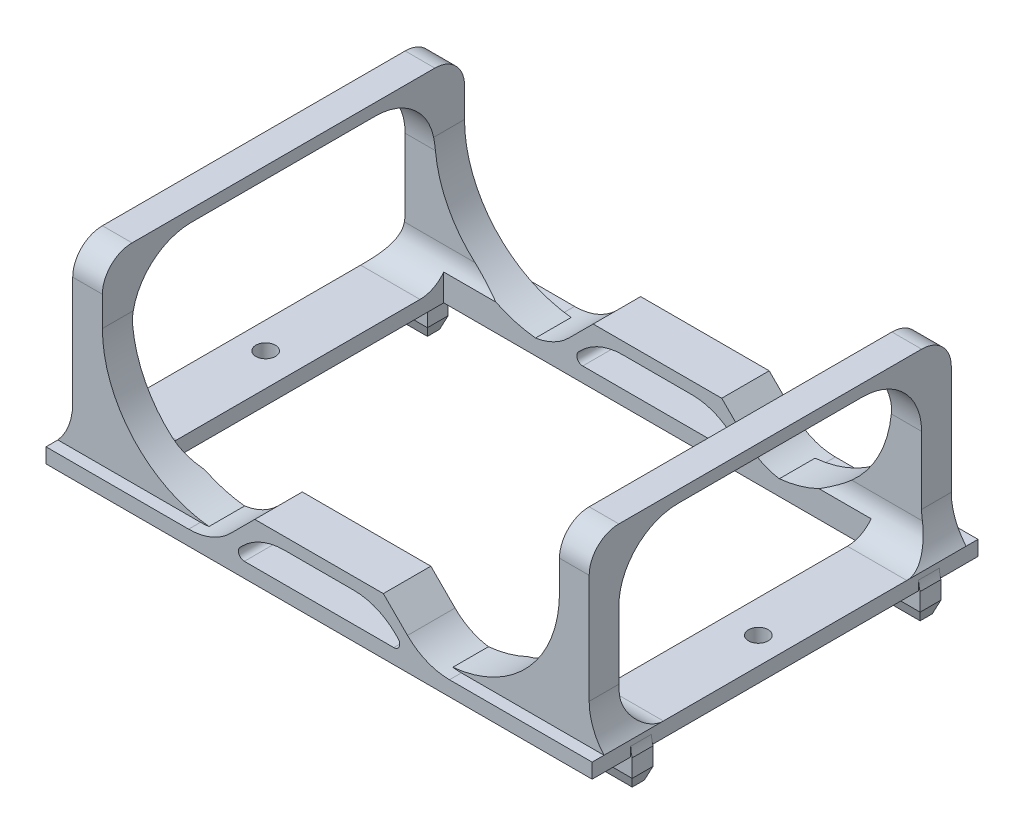
from build123d import *
from OCP.BRepFilletAPI import BRepFilletAPI_MakeChamfer

# Parameters (mm, degrees)
SKETCH1_W           = 10
SKETCH1_H           = 8
SKETCH1_W_2         = 72
SKETCH1_H_2         = 49
BOSS_EXTRUDE1_DEPTH = 2.5
SKETCH2_W           = 5
SKETCH2_H           = 5
BOSS_EXTRUDE2_DEPTH = 30
SKETCH3_W           = 5
SKETCH3_H           = 2
BOSS_EXTRUDE3_DEPTH = 56
EXTRUDE_THIN1_START = -8
EXTRUDE_THIN1_DEPTH = 8
LPATTERN1_START     = -32.5
LPATTERN1_DEPTH     = 57
SKETCH5_W           = 39.65685425
SKETCH5_H           = 49
CUT_EXTRUDE2_DEPTH  = 65.778468645
FILLET1_R           = 20
FILLET2_R           = 10
FILLET3_R           = 5
FILLET4_START       = -32.5
FILLET4_DEPTH       = 8
FILLET4_START_2     = 24.5
FILLET4_2_DEPTH     = 8
FILLET5_R           = 10
FILLET6_R           = 5
FILLET7_R           = 10
FILLET8_R           = 1
SKETCH6_R           = 1.65
CUT_EXTRUDE3_DEPTH  = 2.5
SKETCH7_W           = 9.5
SKETCH7_H           = 3.5
BOSS_EXTRUDE4_DEPTH = 5
CHAMFER1_SIZE       = 2
CHAMFER1_SIZE2      = 0.727940469
FILLET9_R           = 5


with BuildPart() as part:
    # Sketch1 → Boss-Extrude1 (new body)
    with BuildSketch(Plane(origin=(0, 0, 0), x_dir=(1, 0, 0), z_dir=(0, 1, 0))):
        with Locations((-41, 28.5)):
            Rectangle(SKETCH1_W, SKETCH1_H)
        with Locations((0, 28.5)):
            Rectangle(SKETCH1_W_2, SKETCH1_H)
        with Locations((-41, 0)):
            Rectangle(SKETCH1_W, SKETCH1_H_2)
        with Locations((0, -28.5)):
            Rectangle(SKETCH1_W_2, SKETCH1_H)
        with Locations((-41, -28.5)):
            Rectangle(SKETCH1_W, SKETCH1_H)
        with Locations((41, -28.5)):
            Rectangle(SKETCH1_W, SKETCH1_H)
        with Locations((41, 0)):
            Rectangle(SKETCH1_W, SKETCH1_H_2)
        with Locations((41, 28.5)):
            Rectangle(SKETCH1_W, SKETCH1_H)
    extrude(amount=BOSS_EXTRUDE1_DEPTH)

    # Sketch2 → Boss-Extrude2 (add)
    with BuildSketch(Plane(origin=(0, 2.5, 0), x_dir=(1, 0, 0), z_dir=(0, 1, 0))):
        with Locations((-41, 28)):
            Rectangle(SKETCH2_W, SKETCH2_H)
        with Locations((41, 28)):
            Rectangle(SKETCH2_W, SKETCH2_H)
        with Locations((41, -28)):
            Rectangle(SKETCH2_W, SKETCH2_H)
        with Locations((-41, -28)):
            Rectangle(SKETCH2_W, SKETCH2_H)
    extrude(amount=BOSS_EXTRUDE2_DEPTH)

    # Sketch3 → Boss-Extrude3 (add)
    with BuildSketch(Plane.XY.offset(30.5)):
        with Locations((-41, 31.5)):
            Rectangle(SKETCH3_W, SKETCH3_H)
        with Locations((41, 31.5)):
            Rectangle(SKETCH3_W, SKETCH3_H)
    extrude(amount=-BOSS_EXTRUDE3_DEPTH)

    # Sketch4 → Extrude-Thin1 (add)
    with BuildSketch(Plane.XY.offset(32.5).offset(EXTRUDE_THIN1_START)):
        Polygon((-19.828427125, 0.5), (-10.828427125, 9.5), (10.828427125, 9.5), (19.828427125, 0.5), align=None)
        Polygon((-15, 2.5), (-10, 7.5), (10, 7.5), (15, 2.5), align=None, mode=Mode.SUBTRACT)
    extrude(amount=EXTRUDE_THIN1_DEPTH)

    # LPattern1: read off the stored shape, not the designer's step
    # LPattern1 outline → LPattern1 (add)
    with BuildSketch(Plane.XY.offset(LPATTERN1_START)):
        Polygon((10.828427125, 9.5), (-10.828427125, 9.5), (-19.828427125, 0.5), (19.828427125, 0.5), align=None)
        Polygon((10, 7.5), (15, 2.5), (-15, 2.5), (-10, 7.5), align=None, mode=Mode.SUBTRACT)
    extrude(amount=LPATTERN1_DEPTH)

    # Sketch5 → Cut-Extrude2 (cut, through all)
    with BuildSketch(Plane.XZ.offset(-0.5)):
        Rectangle(SKETCH5_W, SKETCH5_H)
    extrude(amount=-CUT_EXTRUDE2_DEPTH, mode=Mode.SUBTRACT)

    # Fillet1
    fillet1_edges = [part.edges().sort_by_distance(p)[0] for p in [
        (-38.5, 2.5, -28),
        (38.5, 2.5, -28),
        (38.5, 2.5, 28),
        (-38.5, 2.5, 28),
    ]]
    fillet(fillet1_edges, radius=FILLET1_R)

    # Fillet2
    fillet2_edges = [part.edges().sort_by_distance(p)[0] for p in [
        (-41, 30.5, 25.5),
        (-41, 30.5, -25.5),
        (41, 30.5, 25.5),
        (41, 30.5, -25.5),
    ]]
    fillet(fillet2_edges, radius=FILLET2_R)

    # Fillet3
    fillet3_edges = [part.edges().sort_by_distance(p)[0] for p in [
        (-41, 32.5, -30.5),
        (41, 32.5, -30.5),
        (41, 32.5, 30.5),
        (-41, 32.5, 30.5),
    ]]
    fillet(fillet3_edges, radius=FILLET3_R)

    # Fillet4: read off the stored shape, not the designer's step
    # Fillet4 outline → Fillet4 (add)
    with BuildSketch(Plane.XY.offset(FILLET4_START)):
        with BuildLine():
            Line((17.828427125, 2.5), (21.970562748, 2.5))
            ThreePointArc((21.970562748, 2.5), (18.143728425, 3.261204675), (14.899494937, 5.428932188))
            Line((14.899494937, 5.428932188), (17.828427125, 2.5))
        make_face()
        with BuildLine():
            ThreePointArc((-14.899494937, 5.428932188), (-18.143728425, 3.261204675), (-21.970562748, 2.5))
            Line((-21.970562748, 2.5), (-17.828427125, 2.5))
            Line((-17.828427125, 2.5), (-14.899494937, 5.428932188))
        make_face()
    extrude(amount=FILLET4_DEPTH)

    # Fillet4 2 outline → Fillet4 2 (add)
    with BuildSketch(Plane.XY.offset(FILLET4_START_2)):
        with BuildLine():
            Line((17.828427125, 2.5), (21.970562748, 2.5))
            ThreePointArc((21.970562748, 2.5), (18.143728425, 3.261204675), (14.899494937, 5.428932188))
            Line((14.899494937, 5.428932188), (17.828427125, 2.5))
        make_face()
        with BuildLine():
            ThreePointArc((-14.899494937, 5.428932188), (-18.143728425, 3.261204675), (-21.970562748, 2.5))
            Line((-21.970562748, 2.5), (-17.828427125, 2.5))
            Line((-17.828427125, 2.5), (-14.899494937, 5.428932188))
        make_face()
    extrude(amount=FILLET4_2_DEPTH)

    # Fillet5
    # the kernel refuses this fillet: 10 mm, written as the material it adds along each edge
    with BuildSketch(Plane(origin=(-43.5, 2.5, -25.5), x_dir=(-1, 0, 0), z_dir=(0, 0, -1)), Plane(origin=(43.5, 2.5, -30.5), x_dir=(1, 0, 0), z_dir=(0, 0, 1)), Plane(origin=(43.5, 2.5, 25.5), x_dir=(1, 0, 0), z_dir=(0, 0, 1)), Plane(origin=(-43.5, 2.5, 30.5), x_dir=(-1, 0, 0), z_dir=(0, 0, -1))) as fillet5_piece_1:
        with BuildLine():
            CenterArc((10, 6.614378278), FILLET5_R, 180, 41.409622109)
            Line((0, 6.614378278), (-0.2, 6.614378278))
            Line((-0.2, 6.614378278), (-0.2, 0))
            Line((-0.2, 0), (0, -0.2))
            ThreePointArc((0, -0.2), (1.25, -0.2), (2.35, -0.132287566))
            Line((2.35, -0.132287566), (2.5, 0))
        make_face()
    extrude(amount=5)

    # Fillet6
    # the kernel refuses this fillet: 5 mm, written as the material it adds along each edge
    with BuildSketch(Plane(origin=(58.5, 2.5, -25.5), x_dir=(0, 1, 0), z_dir=(-1, 0, 0))) as fillet6_piece_1_section:
        with BuildLine():
            CenterArc((FILLET6_R, -FILLET6_R), FILLET6_R, 90, 90)
            Line((0, -FILLET6_R), (0, 0))
            Line((0, 0), (FILLET6_R, 0))
        make_face()
    fillet6_piece_1 = extrude(amount=49.029437252, mode=Mode.PRIVATE)
    fillet6_piece_1 = split(fillet6_piece_1, bisect_by=Plane(origin=(58.5, 2.5, -24.5), z_dir=(0, 0, -1)), keep=Keep.TOP, mode=Mode.PRIVATE)
    fillet6_piece_1 = fillet6_piece_1 - Plane(origin=(53.5, 9.114378278, -25.5), x_dir=(1, 0, 0), z_dir=(0, 0, -1)) * Cylinder(10, 119, mode=Mode.PRIVATE)
    fillet6_piece_1 = fillet6_piece_1 - Plane(origin=(18.5, 22.5, -25.5), x_dir=(0, -1, 0), z_dir=(0, 0, -1)) * Cylinder(20, 119, mode=Mode.PRIVATE)
    fillet6_piece_1 = split(fillet6_piece_1, bisect_by=Plane(origin=(38.164213562, -17.835786438, -25.5), z_dir=(0.7071067811865489, 0.7071067811865462, 0)), keep=Keep.TOP, mode=Mode.PRIVATE)
    add(fillet6_piece_1)
    with BuildSketch(Plane(origin=(58.5, 2.5, -25.5), x_dir=(0, 1, 0), z_dir=(-1, 0, 0))) as fillet6_piece_2_section:
        with BuildLine():
            CenterArc((FILLET6_R, -FILLET6_R), FILLET6_R, 90, 90)
            Line((0, -FILLET6_R), (0, 0))
            Line((0, 0), (FILLET6_R, 0))
        make_face()
    fillet6_piece_2 = extrude(amount=49.029437252, mode=Mode.PRIVATE)
    fillet6_piece_2 = fillet6_piece_2 - Plane(origin=(53.5, 9.114378278, -25.5), x_dir=(1, 0, 0), z_dir=(0, 0, -1)) * Cylinder(10, 119, mode=Mode.PRIVATE)
    fillet6_piece_2 = split(fillet6_piece_2, bisect_by=Plane(origin=(36, 2.5, -25.5), z_dir=(1, 0, 0)), keep=Keep.TOP, mode=Mode.PRIVATE)
    add(fillet6_piece_2)
    with BuildSketch(Plane(origin=(-9.470562748, 2.5, 25.5), x_dir=(0, 1, 0), z_dir=(-1, 0, 0))) as fillet6_piece_3_section:
        with BuildLine():
            CenterArc((FILLET6_R, FILLET6_R), FILLET6_R, 180, 90)
            Line((0, FILLET6_R), (0, 0))
            Line((0, 0), (FILLET6_R, 0))
        make_face()
    fillet6_piece_3 = extrude(amount=49.029437252, mode=Mode.PRIVATE)
    fillet6_piece_3 = fillet6_piece_3 - Plane(origin=(-18.5, 22.5, 25.5), x_dir=(0, -1, 0), z_dir=(0, 0, 1)) * Cylinder(20, 119, mode=Mode.PRIVATE)
    fillet6_piece_3 = split(fillet6_piece_3, bisect_by=Plane(origin=(-13.649494936, 6.678932189, 25.5), z_dir=(-0.7071067811865475, 0.7071067811865476, 0)), keep=Keep.TOP, mode=Mode.PRIVATE)
    fillet6_piece_3 = split(fillet6_piece_3, bisect_by=Plane(origin=(-9.470562748, 2.5, 24.5), z_dir=(0, 0, 1)), keep=Keep.TOP, mode=Mode.PRIVATE)
    fillet6_piece_3 = fillet6_piece_3 - Plane(origin=(-53.5, 9.114378278, 25.5), x_dir=(-1, 0, 0), z_dir=(0, 0, 1)) * Cylinder(10, 119, mode=Mode.PRIVATE)
    add(fillet6_piece_3)
    with BuildSketch(Plane(origin=(-9.470562748, 2.5, 25.5), x_dir=(0, 1, 0), z_dir=(-1, 0, 0))) as fillet6_piece_4_section:
        with BuildLine():
            CenterArc((FILLET6_R, FILLET6_R), FILLET6_R, 180, 90)
            Line((0, FILLET6_R), (0, 0))
            Line((0, 0), (FILLET6_R, 0))
        make_face()
    fillet6_piece_4 = extrude(amount=49.029437252, mode=Mode.PRIVATE)
    fillet6_piece_4 = split(fillet6_piece_4, bisect_by=Plane(origin=(-36, 2.5, 25.5), z_dir=(-1, 0, 0)), keep=Keep.TOP, mode=Mode.PRIVATE)
    fillet6_piece_4 = fillet6_piece_4 - Plane(origin=(-53.5, 9.114378278, 25.5), x_dir=(-1, 0, 0), z_dir=(0, 0, 1)) * Cylinder(10, 119, mode=Mode.PRIVATE)
    add(fillet6_piece_4)
    with BuildSketch(Plane(origin=(-58.5, 2.5, -25.5), x_dir=(0, 0, 1), z_dir=(1, 0, 0))) as fillet6_piece_5_section:
        with BuildLine():
            CenterArc((FILLET6_R, -FILLET6_R), FILLET6_R, 90, 90)
            Line((0, -FILLET6_R), (0, 0))
            Line((0, 0), (FILLET6_R, 0))
        make_face()
    fillet6_piece_5 = extrude(amount=49.029437252, mode=Mode.PRIVATE)
    fillet6_piece_5 = fillet6_piece_5 - Plane(origin=(-53.5, 9.114378278, -25.5), x_dir=(-1, 0, 0), z_dir=(0, 0, 1)) * Cylinder(10, 119, mode=Mode.PRIVATE)
    fillet6_piece_5 = split(fillet6_piece_5, bisect_by=Plane(origin=(-36, 2.5, -25.5), z_dir=(-1, 0, 0)), keep=Keep.TOP, mode=Mode.PRIVATE)
    add(fillet6_piece_5)
    with BuildSketch(Plane(origin=(-58.5, 2.5, -25.5), x_dir=(0, 0, 1), z_dir=(1, 0, 0))) as fillet6_piece_6_section:
        with BuildLine():
            CenterArc((FILLET6_R, -FILLET6_R), FILLET6_R, 90, 90)
            Line((0, -FILLET6_R), (0, 0))
            Line((0, 0), (FILLET6_R, 0))
        make_face()
    fillet6_piece_6 = extrude(amount=49.029437252, mode=Mode.PRIVATE)
    fillet6_piece_6 = split(fillet6_piece_6, bisect_by=Plane(origin=(-58.5, 2.5, -24.5), z_dir=(0, 0, -1)), keep=Keep.TOP, mode=Mode.PRIVATE)
    fillet6_piece_6 = split(fillet6_piece_6, bisect_by=Plane(origin=(-38.164213563, -17.835786438, -25.5), z_dir=(-0.7071067811865475, 0.7071067811865476, 0)), keep=Keep.TOP, mode=Mode.PRIVATE)
    fillet6_piece_6 = split(fillet6_piece_6, bisect_by=Plane(origin=(-36, 2.5, -25.5), z_dir=(1, 0, 0)), keep=Keep.TOP, mode=Mode.PRIVATE)
    fillet6_piece_6 = fillet6_piece_6 - Plane(origin=(-18.5, 22.5, -25.5), x_dir=(0, -1, 0), z_dir=(0, 0, 1)) * Cylinder(20, 119, mode=Mode.PRIVATE)
    add(fillet6_piece_6)
    with BuildSketch(Plane(origin=(9.470562748, 2.5, 25.5), x_dir=(0, 1, 0), z_dir=(1, 0, 0))) as fillet6_piece_7_section:
        with BuildLine():
            CenterArc((FILLET6_R, -FILLET6_R), FILLET6_R, 90, 90)
            Line((0, -FILLET6_R), (0, 0))
            Line((0, 0), (FILLET6_R, 0))
        make_face()
    fillet6_piece_7 = extrude(amount=49.029437252, mode=Mode.PRIVATE)
    fillet6_piece_7 = split(fillet6_piece_7, bisect_by=Plane(origin=(13.649494936, 6.678932188, 25.5), z_dir=(0.7071067811865489, 0.7071067811865462, 0)), keep=Keep.TOP, mode=Mode.PRIVATE)
    fillet6_piece_7 = fillet6_piece_7 - Plane(origin=(53.5, 9.114378278, 25.5), x_dir=(1, 0, 0), z_dir=(0, 0, -1)) * Cylinder(10, 119, mode=Mode.PRIVATE)
    fillet6_piece_7 = fillet6_piece_7 - Plane(origin=(18.5, 22.5, 25.5), x_dir=(0, -1, 0), z_dir=(0, 0, -1)) * Cylinder(20, 119, mode=Mode.PRIVATE)
    fillet6_piece_7 = split(fillet6_piece_7, bisect_by=Plane(origin=(9.470562748, 2.5, 24.5), z_dir=(0, 0, 1)), keep=Keep.TOP, mode=Mode.PRIVATE)
    add(fillet6_piece_7)
    with BuildSketch(Plane(origin=(9.470562748, 2.5, 25.5), x_dir=(0, 1, 0), z_dir=(1, 0, 0))) as fillet6_piece_8_section:
        with BuildLine():
            CenterArc((FILLET6_R, -FILLET6_R), FILLET6_R, 90, 90)
            Line((0, -FILLET6_R), (0, 0))
            Line((0, 0), (FILLET6_R, 0))
        make_face()
    fillet6_piece_8 = extrude(amount=49.029437252, mode=Mode.PRIVATE)
    fillet6_piece_8 = fillet6_piece_8 - Plane(origin=(53.5, 9.114378278, 25.5), x_dir=(1, 0, 0), z_dir=(0, 0, -1)) * Cylinder(10, 119, mode=Mode.PRIVATE)
    fillet6_piece_8 = split(fillet6_piece_8, bisect_by=Plane(origin=(36, 2.5, 25.5), z_dir=(1, 0, 0)), keep=Keep.TOP, mode=Mode.PRIVATE)
    add(fillet6_piece_8)

    # Fillet7
    fillet7_edges = [part.edges().sort_by_distance(p)[0] for p in [
        (-10, 7.5, -28.5),
        (10, 7.5, -28.5),
        (10, 7.5, 28.5),
        (-10, 7.5, 28.5),
    ]]
    fillet(fillet7_edges, radius=FILLET7_R)

    # Fillet8
    fillet8_edges = [part.edges().sort_by_distance(p)[0] for p in [
        (-15, 2.5, -28.5),
        (15, 2.5, -28.5),
        (15, 2.5, 28.5),
        (-15, 2.5, 28.5),
    ]]
    fillet(fillet8_edges, radius=FILLET8_R)

    # Sketch6 → Cut-Extrude3 (cut)
    with BuildSketch(Plane.XZ):
        with Locations(Location((-41.5, 0, 0), (0, 0, 270))):
            Circle(SKETCH6_R)
        with Locations(Location((41.5, 0, 0), (0, 0, 270))):
            Circle(SKETCH6_R)
    extrude(amount=-CUT_EXTRUDE3_DEPTH, mode=Mode.SUBTRACT)

    # Sketch7 → Boss-Extrude4 (add)
    with BuildSketch(Plane.XZ):
        with Locations((-41.5, 24.25)):
            Rectangle(SKETCH7_W, SKETCH7_H)
        with Locations((-41.5, -24.25)):
            Rectangle(SKETCH7_W, SKETCH7_H)
        with Locations((41.5, -24.25)):
            Rectangle(SKETCH7_W, SKETCH7_H)
        with Locations((41.5, 24.25)):
            Rectangle(SKETCH7_W, SKETCH7_H)
    extrude(amount=BOSS_EXTRUDE4_DEPTH)

    # Chamfer1: one chamfer whose edges measure the first distance from different faces: ONE call of the kernel's chamfer builder (chamfer() names one face for all edges)
    chamfer1_edges_1 = [part.edges().sort_by_distance(p)[0] for p in [
        (-46.25, -5, 24.25),
    ]]
    chamfer1_side_1 = [part.faces().sort_by_distance(p)[0] for p in [
        (-46.25, -2.5, 24.25),
    ]]
    chamfer1_edges_2 = [part.edges().sort_by_distance(p)[0] for p in [
        (-41.5, -5, 22.5),
    ]]
    chamfer1_side_2 = [part.faces().sort_by_distance(p)[0] for p in [
        (-41.5, -2.5, 22.5),
    ]]
    chamfer1_edges_3 = [part.edges().sort_by_distance(p)[0] for p in [
        (-36.75, -5, 24.25),
    ]]
    chamfer1_side_3 = [part.faces().sort_by_distance(p)[0] for p in [
        (-36.75, -2.5, 24.25),
    ]]
    chamfer1_edges_4 = [part.edges().sort_by_distance(p)[0] for p in [
        (-41.5, -5, 26),
    ]]
    chamfer1_side_4 = [part.faces().sort_by_distance(p)[0] for p in [
        (-41.5, -2.5, 26),
    ]]
    chamfer1_edges_5 = [part.edges().sort_by_distance(p)[0] for p in [
        (-46.25, -5, -24.25),
    ]]
    chamfer1_side_5 = [part.faces().sort_by_distance(p)[0] for p in [
        (-46.25, -2.5, -24.25),
    ]]
    chamfer1_edges_6 = [part.edges().sort_by_distance(p)[0] for p in [
        (-41.5, -5, -26),
    ]]
    chamfer1_side_6 = [part.faces().sort_by_distance(p)[0] for p in [
        (-41.5, -2.5, -26),
    ]]
    chamfer1_edges_7 = [part.edges().sort_by_distance(p)[0] for p in [
        (-36.75, -5, -24.25),
    ]]
    chamfer1_side_7 = [part.faces().sort_by_distance(p)[0] for p in [
        (-36.75, -2.5, -24.25),
    ]]
    chamfer1_edges_8 = [part.edges().sort_by_distance(p)[0] for p in [
        (-41.5, -5, -22.5),
    ]]
    chamfer1_side_8 = [part.faces().sort_by_distance(p)[0] for p in [
        (-41.5, -2.5, -22.5),
    ]]
    chamfer1_edges_9 = [part.edges().sort_by_distance(p)[0] for p in [
        (46.25, -5, -24.25),
    ]]
    chamfer1_side_9 = [part.faces().sort_by_distance(p)[0] for p in [
        (46.25, -2.5, -24.25),
    ]]
    chamfer1_edges_10 = [part.edges().sort_by_distance(p)[0] for p in [
        (41.5, -5, -22.5),
    ]]
    chamfer1_side_10 = [part.faces().sort_by_distance(p)[0] for p in [
        (41.5, -2.5, -22.5),
    ]]
    chamfer1_edges_11 = [part.edges().sort_by_distance(p)[0] for p in [
        (36.75, -5, -24.25),
    ]]
    chamfer1_side_11 = [part.faces().sort_by_distance(p)[0] for p in [
        (36.75, -2.5, -24.25),
    ]]
    chamfer1_edges_12 = [part.edges().sort_by_distance(p)[0] for p in [
        (41.5, -5, -26),
    ]]
    chamfer1_side_12 = [part.faces().sort_by_distance(p)[0] for p in [
        (41.5, -2.5, -26),
    ]]
    chamfer1_edges_13 = [part.edges().sort_by_distance(p)[0] for p in [
        (46.25, -5, 24.25),
    ]]
    chamfer1_side_13 = [part.faces().sort_by_distance(p)[0] for p in [
        (46.25, -2.5, 24.25),
    ]]
    chamfer1_edges_14 = [part.edges().sort_by_distance(p)[0] for p in [
        (41.5, -5, 26),
    ]]
    chamfer1_side_14 = [part.faces().sort_by_distance(p)[0] for p in [
        (41.5, -2.5, 26),
    ]]
    chamfer1_edges_15 = [part.edges().sort_by_distance(p)[0] for p in [
        (36.75, -5, 24.25),
    ]]
    chamfer1_side_15 = [part.faces().sort_by_distance(p)[0] for p in [
        (36.75, -2.5, 24.25),
    ]]
    chamfer1_edges_16 = [part.edges().sort_by_distance(p)[0] for p in [
        (41.5, -5, 22.5),
    ]]
    chamfer1_side_16 = [part.faces().sort_by_distance(p)[0] for p in [
        (41.5, -2.5, 22.5),
    ]]
    chamfer1 = BRepFilletAPI_MakeChamfer(part.part.solid().wrapped)
    for e in chamfer1_edges_1:
        chamfer1.Add(CHAMFER1_SIZE, CHAMFER1_SIZE2, e.wrapped, chamfer1_side_1[0].wrapped)  # the first distance lies on this face
    for e in chamfer1_edges_2:
        chamfer1.Add(CHAMFER1_SIZE, CHAMFER1_SIZE2, e.wrapped, chamfer1_side_2[0].wrapped)  # the first distance lies on this face
    for e in chamfer1_edges_3:
        chamfer1.Add(CHAMFER1_SIZE, CHAMFER1_SIZE2, e.wrapped, chamfer1_side_3[0].wrapped)  # the first distance lies on this face
    for e in chamfer1_edges_4:
        chamfer1.Add(CHAMFER1_SIZE, CHAMFER1_SIZE2, e.wrapped, chamfer1_side_4[0].wrapped)  # the first distance lies on this face
    for e in chamfer1_edges_5:
        chamfer1.Add(CHAMFER1_SIZE, CHAMFER1_SIZE2, e.wrapped, chamfer1_side_5[0].wrapped)  # the first distance lies on this face
    for e in chamfer1_edges_6:
        chamfer1.Add(CHAMFER1_SIZE, CHAMFER1_SIZE2, e.wrapped, chamfer1_side_6[0].wrapped)  # the first distance lies on this face
    for e in chamfer1_edges_7:
        chamfer1.Add(CHAMFER1_SIZE, CHAMFER1_SIZE2, e.wrapped, chamfer1_side_7[0].wrapped)  # the first distance lies on this face
    for e in chamfer1_edges_8:
        chamfer1.Add(CHAMFER1_SIZE, CHAMFER1_SIZE2, e.wrapped, chamfer1_side_8[0].wrapped)  # the first distance lies on this face
    for e in chamfer1_edges_9:
        chamfer1.Add(CHAMFER1_SIZE, CHAMFER1_SIZE2, e.wrapped, chamfer1_side_9[0].wrapped)  # the first distance lies on this face
    for e in chamfer1_edges_10:
        chamfer1.Add(CHAMFER1_SIZE, CHAMFER1_SIZE2, e.wrapped, chamfer1_side_10[0].wrapped)  # the first distance lies on this face
    for e in chamfer1_edges_11:
        chamfer1.Add(CHAMFER1_SIZE, CHAMFER1_SIZE2, e.wrapped, chamfer1_side_11[0].wrapped)  # the first distance lies on this face
    for e in chamfer1_edges_12:
        chamfer1.Add(CHAMFER1_SIZE, CHAMFER1_SIZE2, e.wrapped, chamfer1_side_12[0].wrapped)  # the first distance lies on this face
    for e in chamfer1_edges_13:
        chamfer1.Add(CHAMFER1_SIZE, CHAMFER1_SIZE2, e.wrapped, chamfer1_side_13[0].wrapped)  # the first distance lies on this face
    for e in chamfer1_edges_14:
        chamfer1.Add(CHAMFER1_SIZE, CHAMFER1_SIZE2, e.wrapped, chamfer1_side_14[0].wrapped)  # the first distance lies on this face
    for e in chamfer1_edges_15:
        chamfer1.Add(CHAMFER1_SIZE, CHAMFER1_SIZE2, e.wrapped, chamfer1_side_15[0].wrapped)  # the first distance lies on this face
    for e in chamfer1_edges_16:
        chamfer1.Add(CHAMFER1_SIZE, CHAMFER1_SIZE2, e.wrapped, chamfer1_side_16[0].wrapped)  # the first distance lies on this face
    add(Compound.cast(chamfer1.Shape()), mode=Mode.REPLACE)

    # Fillet9
    # the kernel refuses this fillet: 5 mm, written as the material it adds along each edge
    with BuildSketch(Plane(origin=(-46, 0, -26), x_dir=(0, 1, 0), z_dir=(0, 0, 1)), Plane(origin=(-46, 0, 22.5), x_dir=(0, 1, 0), z_dir=(0, 0, 1))) as fillet9_piece_1:
        with BuildLine():
            CenterArc((1.5612495, 5), FILLET9_R, 251.805127661, 18.194872339)
            Line((0, 0.25), (0, 0))
            Line((0, 0), (1.5612495, 0))
        make_face()
    extrude(amount=3.5)
    with BuildSketch(Plane(origin=(46, 0, 22.5), x_dir=(0, 1, 0), z_dir=(0, 0, 1))) as fillet9_piece_2:
        with BuildLine():
            CenterArc((1.5612495, -5), FILLET9_R, 90, 18.194872339)
            Line((0, -0.25), (0, 0))
            Line((0, 0), (1.5612495, 0))
        make_face()
    extrude(amount=3.5)
    with BuildSketch(Plane(origin=(46, 0, -26), x_dir=(1.0, 2.1955770534809874e-12, 0), z_dir=(0, 0, 1))) as fillet9_piece_3:
        with BuildLine():
            CenterArc((5, 1.5612495), FILLET9_R, 180, 18.194872339)
            Line((0, 1.5612495), (0, 0))
            Line((0, 0), (0.25, 0))
        make_face()
    extrude(amount=3.5)


solid = part.part
